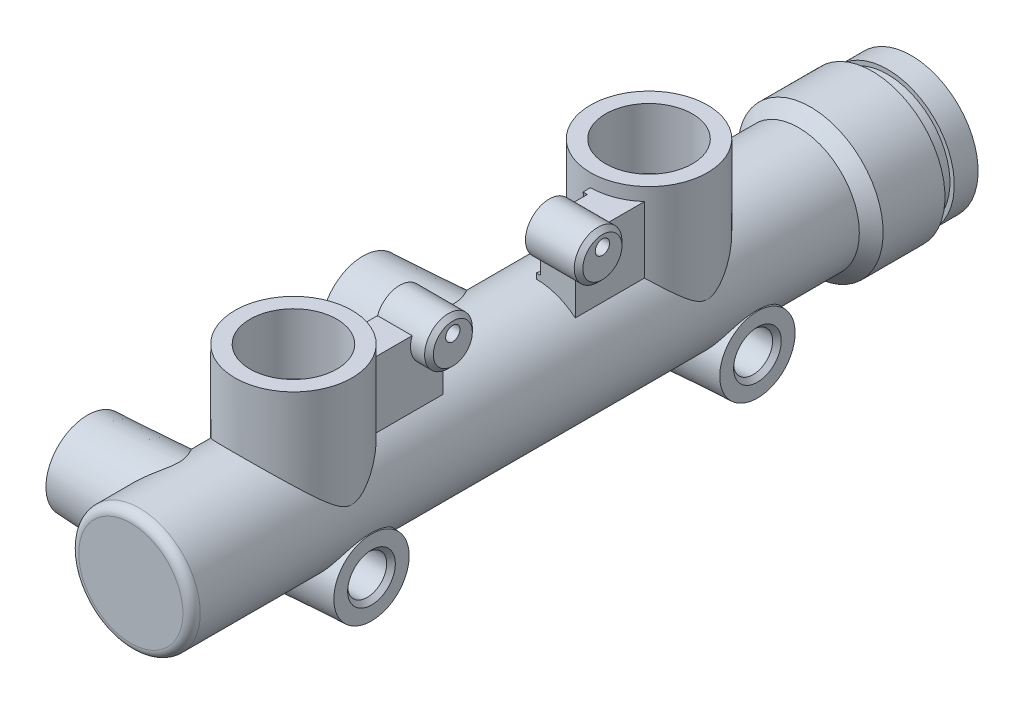
from build123d import *

# Parameters (mm, degrees)
CHANFRO1_SIZE                      = 2.75
ESBO_O2_R                          = 10.75
CORTE_EXTRUS_O1_DEPTH              = 4
ESBO_O4_R                          = 11.55
CORTE_EXTRUS_O2_DEPTH              = 0.8
ESBO_O5_R                          = 10.75
CORTE_EXTRUS_O3_DEPTH              = 18
FILETE1_R                          = 2
RESSALTO_EXTRUS_O1_REACH           = 188.477
RESSALTO_EXTRUS_O1_END_RADIUS      = 14
ESBO_O7_R                          = 13.5
ESBO_O8_R                          = 9.4
RESSALTO_EXTRUS_O2_DEPTH           = 13.5
RESSALTO_EXTRUS_O2_DRAFT           = 3
RESSALTO_EXTRUS_O2_PROFILE_2_DEPTH = 13.5
RESSALTO_EXTRUS_O2_PROFILE_2_DRAFT = 3
ESBO_O8_2_R                        = 9.4
RESSALTO_EXTRUS_O3_DEPTH           = 22.5
RESSALTO_EXTRUS_O3_DRAFT           = -3
RESSALTO_EXTRUS_O3_PROFILE_2_DEPTH = 22.5
RESSALTO_EXTRUS_O3_PROFILE_2_DRAFT = -3
ESBO_O9_R                          = 11
RESSALTO_EXTRUS_O4_DEPTH           = 27
RESSALTO_EXTRUS_O4_DRAFT           = -3
RESSALTO_EXTRUS_O4_PROFILE_2_DEPTH = 27
RESSALTO_EXTRUS_O4_PROFILE_2_DRAFT = -3
ESBO_O6_R                          = 9.525
CORTE_EXTRUS_O4_DEPTH              = 150
FURO_DE_DI_METRO_9_0_9_1_D         = 9
CHANFRO2_SIZE                      = 1
FURO_ROSCADO_DE_M10X1_251_D        = 8.8
FURO_ROSCADO_DE_M10X1_251_DEPTH    = 14.856213276
FURO_ROSCADO_DE_M10X1_251_TIP      = 2.643786724
CHANFRO3_SIZE                      = 0.75
FURO_DE_DI_METRO_3_0_3_1_REACH     = 189.497
FURO_DE_DI_METRO_3_0_3_1_BORE_R    = 1.5
ESBO_O20_W                         = 16
ESBO_O20_H                         = 16
RESSALTO_EXTRUS_O5_DEPTH           = 9
FURO_DE_DI_METRO_20_0_20_1_D       = 20
FURO_DE_DI_METRO_20_0_20_1_DEPTH   = 13.99139381
FURO_DE_DI_METRO_20_0_20_1_TIP     = 6.00860619
ESBO_O21_R                         = 5.5
RESSALTO_EXTRUS_O6_DEPTH           = 13.25
ESBO_O22_R                         = 9
CORTE_EXTRUS_O6_DEPTH              = 1
CHANFRO4_SIZE                      = 1
FURO_ROSCADO_DE_M4X0_71_D          = 3.3


with BuildPart() as part:
    # Esboço1 → Revolução1 (revolve)
    with BuildSketch(Plane(origin=(0, 0, 0), x_dir=(0, 0, -1), z_dir=(1, 0, 0)), mode=Mode.PRIVATE) as revolu_o1_sk:
        Polygon((0, 0), (0, 14), (154, 14), (154, 16.75), (180, 16.75), (180, 0), align=None)
    revolve(revolu_o1_sk.sketch.rotate(Axis((0, 0, 0), (0, 0, -1)), 90), axis=Axis((0, 0, 0), (0, 0, -1)))

    # Chanfro1
    chanfro1_edges = [part.edges().sort_by_distance(p)[0] for p in [
        (-16.75, 0, -154),
    ]]
    chamfer(chanfro1_edges, length=CHANFRO1_SIZE - 0.0001)  # a hair under: the kernel refuses the full size

    # Esboço2 → Corte-extrusão1 (cut)
    with BuildSketch(Plane(origin=(0, 0, -180), x_dir=(-1, 0, 0), z_dir=(0, 0, -1))):
        Circle(ESBO_O2_R)
    extrude(amount=-CORTE_EXTRUS_O1_DEPTH, mode=Mode.SUBTRACT)

    # Esboço3 → Corte-Revolução1 (revolve, cut)
    with BuildSketch(Plane(origin=(0, 0, 0), x_dir=(0, 0, -1), z_dir=(1, 0, 0)), mode=Mode.PRIVATE) as corte_revolu_o1_sk:
        Polygon((180, 15.4), (174.5, 15.4), (174.5, 14.4), (171, 14.4), (171, 16.75), (180, 16.75), align=None)
    revolve(corte_revolu_o1_sk.sketch.rotate(Axis((0, 0, -180), (0, 0, 1)), 90), axis=Axis((0, 0, -180), (0, 0, 1)), mode=Mode.SUBTRACT)

    # Esboço4 → Corte-extrusão2 (cut)
    with BuildSketch(Plane(origin=(0, 0, -176), x_dir=(-1, 0, 0), z_dir=(0, 0, -1))):
        Circle(ESBO_O4_R)
    extrude(amount=-CORTE_EXTRUS_O2_DEPTH, mode=Mode.SUBTRACT)

    # Esboço5 → Corte-extrusão3 (cut)
    with BuildSketch(Plane(origin=(0, 0, -175.2), x_dir=(-1, 0, 0), z_dir=(0, 0, -1))):
        Circle(ESBO_O5_R)
    extrude(amount=-CORTE_EXTRUS_O3_DEPTH, mode=Mode.SUBTRACT)

    # Filete1
    filete1_edges = [part.edges().sort_by_distance(p)[0] for p in [
        (-14, 0, 0),
    ]]
    fillet(filete1_edges, radius=FILETE1_R)

    # Ressalto-extrusão1: up to this cylinder (the profile starts outside it)
    ressalto_extrus_o1_end = Plane(origin=(0, 0, -78.5), z_dir=(0, 0, 1)) * Cylinder(RESSALTO_EXTRUS_O1_END_RADIUS, 487.954, mode=Mode.PRIVATE)
    # Esboço7 → Ressalto-extrusão1 (add, up to the surface)
    with BuildSketch(Plane(origin=(0, 29, 0), x_dir=(1, 0, 0), z_dir=(0, 1, 0)), mode=Mode.PRIVATE) as ressalto_extrus_o1_sk1:
        with Locations(Location((0, 37.5, 0), (0, 0, 270))):
            Circle(ESBO_O7_R)
    ressalto_extrus_o1_tool1 = extrude(ressalto_extrus_o1_sk1.sketch, amount=-RESSALTO_EXTRUS_O1_REACH, mode=Mode.PRIVATE) - ressalto_extrus_o1_end
    add(ressalto_extrus_o1_tool1.solids().sort_by_distance((0, 29, -37.5))[0])
    # Esboço7 → Ressalto-extrusão1 (add, up to the surface)
    with BuildSketch(Plane(origin=(0, 29, 0), x_dir=(1, 0, 0), z_dir=(0, 1, 0)), mode=Mode.PRIVATE) as ressalto_extrus_o1_sk2:
        with Locations(Location((0, 119.5, 0), (0, 0, 270))):
            Circle(ESBO_O7_R)
    ressalto_extrus_o1_tool2 = extrude(ressalto_extrus_o1_sk2.sketch, amount=-RESSALTO_EXTRUS_O1_REACH, mode=Mode.PRIVATE) - ressalto_extrus_o1_end
    add(ressalto_extrus_o1_tool2.solids().sort_by_distance((0, 29, -119.5))[0])


with BuildPart() as ressalto_extrus_o2_tool:
    # Esboço8 → Ressalto-extrusão2 (with draft: the straight prism first)
    with BuildSketch(Plane(origin=(0, 0, 0), x_dir=(0, 0, -1), z_dir=(1, 0, 0))):
        with Locations((42, -13.1)):
            Circle(ESBO_O8_R)
    extrude(amount=RESSALTO_EXTRUS_O2_DEPTH)
    # Ressalto-extrusão2: the draft: its side faces are tilted about the plane it starts from
    ressalto_extrus_o2_sides = [ressalto_extrus_o2_tool.faces().sort_by_distance(p)[0] for p in [
        (6.75, -13.1, -32.6),
    ]]
    draft(ressalto_extrus_o2_sides, Plane(origin=(0, 0, 0), x_dir=(0, 0, -1), z_dir=(1, 0, 0)), RESSALTO_EXTRUS_O2_DRAFT)


with BuildPart() as part_1:
    add(part.part)

    # Ressalto-extrusão2: add ressalto_extrus_o2_tool
    add(ressalto_extrus_o2_tool.part)


with BuildPart() as ressalto_extrus_o2_profile_2_tool:
    # Esboço8 → Ressalto-extrusão2 profile 2 (with draft: the straight prism first)
    with BuildSketch(Plane(origin=(0, 0, 0), x_dir=(0, 0, -1), z_dir=(1, 0, 0))):
        with Locations((131, -13.1)):
            Circle(ESBO_O8_R)
    extrude(amount=RESSALTO_EXTRUS_O2_PROFILE_2_DEPTH)
    # Ressalto-extrusão2 profile 2: the draft: its side faces are tilted about the plane it starts from
    ressalto_extrus_o2_profile_2_sides = [ressalto_extrus_o2_profile_2_tool.faces().sort_by_distance(p)[0] for p in [
        (6.75, -13.1, -121.6),
    ]]
    draft(ressalto_extrus_o2_profile_2_sides, Plane(origin=(0, 0, 0), x_dir=(0, 0, -1), z_dir=(1, 0, 0)), RESSALTO_EXTRUS_O2_PROFILE_2_DRAFT)


with BuildPart() as part_2:
    add(part_1.part)

    # Ressalto-extrusão2 profile 2: add ressalto_extrus_o2_profile_2_tool
    add(ressalto_extrus_o2_profile_2_tool.part)


with BuildPart() as ressalto_extrus_o3_tool:
    # Esboço8<2> → Ressalto-extrusão3 (with draft: the straight prism first)
    with BuildSketch(Plane(origin=(0, 0, 0), x_dir=(0, 0, -1), z_dir=(1, 0, 0))):
        with Locations((42, -13.1)):
            Circle(ESBO_O8_2_R)
    extrude(amount=-RESSALTO_EXTRUS_O3_DEPTH)
    # Ressalto-extrusão3: the draft: its side faces are tilted about the plane it starts from
    ressalto_extrus_o3_sides = [ressalto_extrus_o3_tool.faces().sort_by_distance(p)[0] for p in [
        (-11.25, -13.1, -32.6),
    ]]
    draft(ressalto_extrus_o3_sides, Plane(origin=(0, 0, 0), x_dir=(0, 0, -1), z_dir=(1, 0, 0)), RESSALTO_EXTRUS_O3_DRAFT)


with BuildPart() as part_3:
    add(part_2.part)

    # Ressalto-extrusão3: add ressalto_extrus_o3_tool
    add(ressalto_extrus_o3_tool.part)


with BuildPart() as ressalto_extrus_o3_profile_2_tool:
    # Esboço8<2> → Ressalto-extrusão3 profile 2 (with draft: the straight prism first)
    with BuildSketch(Plane(origin=(0, 0, 0), x_dir=(0, 0, -1), z_dir=(1, 0, 0))):
        with Locations((131, -13.1)):
            Circle(ESBO_O8_2_R)
    extrude(amount=-RESSALTO_EXTRUS_O3_PROFILE_2_DEPTH)
    # Ressalto-extrusão3 profile 2: the draft: its side faces are tilted about the plane it starts from
    ressalto_extrus_o3_profile_2_sides = [ressalto_extrus_o3_profile_2_tool.faces().sort_by_distance(p)[0] for p in [
        (-11.25, -13.1, -121.6),
    ]]
    draft(ressalto_extrus_o3_profile_2_sides, Plane(origin=(0, 0, 0), x_dir=(0, 0, -1), z_dir=(1, 0, 0)), RESSALTO_EXTRUS_O3_PROFILE_2_DRAFT)


with BuildPart() as part_4:
    add(part_3.part)

    # Ressalto-extrusão3 profile 2: add ressalto_extrus_o3_profile_2_tool
    add(ressalto_extrus_o3_profile_2_tool.part)


with BuildPart() as ressalto_extrus_o4_tool:
    # Esboço9 → Ressalto-extrusão4 (with draft: the straight prism first)
    with BuildSketch(Plane(origin=(0, 0, 0), x_dir=(0, 0, -1), z_dir=(1, 0, 0))):
        with Locations((17, 2)):
            Circle(ESBO_O9_R)
    extrude(amount=-RESSALTO_EXTRUS_O4_DEPTH)
    # Ressalto-extrusão4: the draft: its side faces are tilted about the plane it starts from
    ressalto_extrus_o4_sides = [ressalto_extrus_o4_tool.faces().sort_by_distance(p)[0] for p in [
        (-13.5, 2, -6),
    ]]
    draft(ressalto_extrus_o4_sides, Plane(origin=(0, 0, 0), x_dir=(0, 0, -1), z_dir=(1, 0, 0)), RESSALTO_EXTRUS_O4_DRAFT)


with BuildPart() as part_5:
    add(part_4.part)

    # Ressalto-extrusão4: add ressalto_extrus_o4_tool
    add(ressalto_extrus_o4_tool.part)


with BuildPart() as ressalto_extrus_o4_profile_2_tool:
    # Esboço9 → Ressalto-extrusão4 profile 2 (with draft: the straight prism first)
    with BuildSketch(Plane(origin=(0, 0, 0), x_dir=(0, 0, -1), z_dir=(1, 0, 0))):
        with Locations((80.5, 2)):
            Circle(ESBO_O9_R)
    extrude(amount=-RESSALTO_EXTRUS_O4_PROFILE_2_DEPTH)
    # Ressalto-extrusão4 profile 2: the draft: its side faces are tilted about the plane it starts from
    ressalto_extrus_o4_profile_2_sides = [ressalto_extrus_o4_profile_2_tool.faces().sort_by_distance(p)[0] for p in [
        (-13.5, 2, -69.5),
    ]]
    draft(ressalto_extrus_o4_profile_2_sides, Plane(origin=(0, 0, 0), x_dir=(0, 0, -1), z_dir=(1, 0, 0)), RESSALTO_EXTRUS_O4_PROFILE_2_DRAFT)


with BuildPart() as part_6:
    add(part_5.part)

    # Ressalto-extrusão4 profile 2: add ressalto_extrus_o4_profile_2_tool
    add(ressalto_extrus_o4_profile_2_tool.part)

    # Esboço6 → Corte-extrusão4 (cut)
    with BuildSketch(Plane(origin=(0, 0, -157.2), x_dir=(-1, 0, 0), z_dir=(0, 0, -1))):
        Circle(ESBO_O6_R)
    extrude(amount=-CORTE_EXTRUS_O4_DEPTH, mode=Mode.SUBTRACT)

    # Furo de diâmetro Ø9.0 (9)1 (through all)
    with Locations(Plane.ZY.offset(22.5)):
        with Locations((-131, -13.1), (-42, -13.1)):
            Hole(FURO_DE_DI_METRO_9_0_9_1_D / 2)

    # Chanfro2
    chanfro2_edges = [part_6.edges().sort_by_distance(p)[0] for p in [
        (13.5, -13.1, -37.5),
        (-22.5, -13.1, -37.5),
        (13.5, -13.1, -126.5),
        (-22.5, -13.1, -126.5),
    ]]
    chamfer(chanfro2_edges, length=CHANFRO2_SIZE)

    # Furo roscado de M10x1.251
    with Locations(Plane.ZY.offset(27)):
        with Locations((-80.5, 2), (-17, 2)):
            Hole(FURO_ROSCADO_DE_M10X1_251_D / 2, depth=FURO_ROSCADO_DE_M10X1_251_DEPTH)
            with Locations((0, 0, -(FURO_ROSCADO_DE_M10X1_251_DEPTH + FURO_ROSCADO_DE_M10X1_251_TIP / 2))):  # 118° drill point
                Cone(0, FURO_ROSCADO_DE_M10X1_251_D / 2, FURO_ROSCADO_DE_M10X1_251_TIP, mode=Mode.SUBTRACT)

    # Chanfro3
    chanfro3_edges = [part_6.edges().sort_by_distance(p)[0] for p in [
        (-27, 2, -12.6),
        (-27, 2, -76.1),
    ]]
    chamfer(chanfro3_edges, length=CHANFRO3_SIZE)

    # Furo de diâmetro Ø3.0 (3)1 bore → Furo de diâmetro Ø3.0 (3)1 (cut, up to next)
    with BuildSketch(Plane.ZY.offset(27), mode=Mode.PRIVATE) as furo_de_di_metro_3_0_3_1_sk1:
        with Locations((-80.5, 2)):
            Circle(FURO_DE_DI_METRO_3_0_3_1_BORE_R)
    furo_de_di_metro_3_0_3_1_tool1 = extrude(furo_de_di_metro_3_0_3_1_sk1.sketch, amount=-FURO_DE_DI_METRO_3_0_3_1_REACH, mode=Mode.PRIVATE) & part_6.part
    # Furo de diâmetro Ø3.0 (3)1 bore → Furo de diâmetro Ø3.0 (3)1 (cut, up to next)
    with BuildSketch(Plane.ZY.offset(27), mode=Mode.PRIVATE) as furo_de_di_metro_3_0_3_1_sk2:
        with Locations((-17, 2)):
            Circle(FURO_DE_DI_METRO_3_0_3_1_BORE_R)
    furo_de_di_metro_3_0_3_1_tool2 = extrude(furo_de_di_metro_3_0_3_1_sk2.sketch, amount=-FURO_DE_DI_METRO_3_0_3_1_REACH, mode=Mode.PRIVATE) & part_6.part
    add(furo_de_di_metro_3_0_3_1_tool1.solids().sort_by_distance((-27, 2, -80.5))[0], mode=Mode.SUBTRACT)
    add(furo_de_di_metro_3_0_3_1_tool2.solids().sort_by_distance((-27, 2, -17))[0], mode=Mode.SUBTRACT)

    # Esboço20 → Ressalto-extrusão5 (add)
    with BuildSketch(Plane(origin=(9, 0, 0), x_dir=(0, 0, -1), z_dir=(1, 0, 0))):
        with Locations((55, 18)):
            Rectangle(ESBO_O20_W, ESBO_O20_H)
        with Locations((101.5, 18)):
            Rectangle(ESBO_O20_W, ESBO_O20_H)
    extrude(amount=-RESSALTO_EXTRUS_O5_DEPTH)

    # Furo de diâmetro Ø20.0 (20)1
    with Locations(Plane(origin=(0, 29, 0), x_dir=(1, 0, 0), z_dir=(0, 1, 0))):
        with Locations((0, 119.5), (0, 37.5)):
            Hole(FURO_DE_DI_METRO_20_0_20_1_D / 2, depth=FURO_DE_DI_METRO_20_0_20_1_DEPTH)
            with Locations((0, 0, -(FURO_DE_DI_METRO_20_0_20_1_DEPTH + FURO_DE_DI_METRO_20_0_20_1_TIP / 2))):  # 118° drill point
                Cone(0, FURO_DE_DI_METRO_20_0_20_1_D / 2, FURO_DE_DI_METRO_20_0_20_1_TIP, mode=Mode.SUBTRACT)

    # Esboço21 → Ressalto-extrusão6 (add)
    with BuildSketch(Plane(origin=(0, 0, 0), x_dir=(0, 0, -1), z_dir=(1, 0, 0))):
        with Locations(Location((95.5, 24, 0), (0, 0, 248.676313737))):
            Circle(ESBO_O21_R)
        with Locations(Location((61, 24, 0), (0, 0, 158.676313737))):
            Circle(ESBO_O21_R)
    extrude(amount=RESSALTO_EXTRUS_O6_DEPTH)

    # Esboço22 → Corte-extrusão6 (cut)
    with BuildSketch(Plane.ZY):
        with Locations((-95.5, 24)):
            Circle(ESBO_O22_R)
        with Locations((-61, 24)):
            Circle(ESBO_O22_R)
    extrude(amount=-CORTE_EXTRUS_O6_DEPTH, mode=Mode.SUBTRACT)

    # Chanfro4
    chanfro4_edges = [part_6.edges().sort_by_distance(p)[0] for p in [
        (13.25, 29.123475383, -97.5),
        (13.25, 22, -66.123475383),
    ]]
    chamfer(chanfro4_edges, length=CHANFRO4_SIZE)

    # Furo roscado de M4x0.71 (through all)
    with Locations(Plane.ZY.offset(-1)):
        with Locations((-95.5, 26), (-61, 26)):
            Hole(FURO_ROSCADO_DE_M4X0_71_D / 2)


solid = part_6.part
